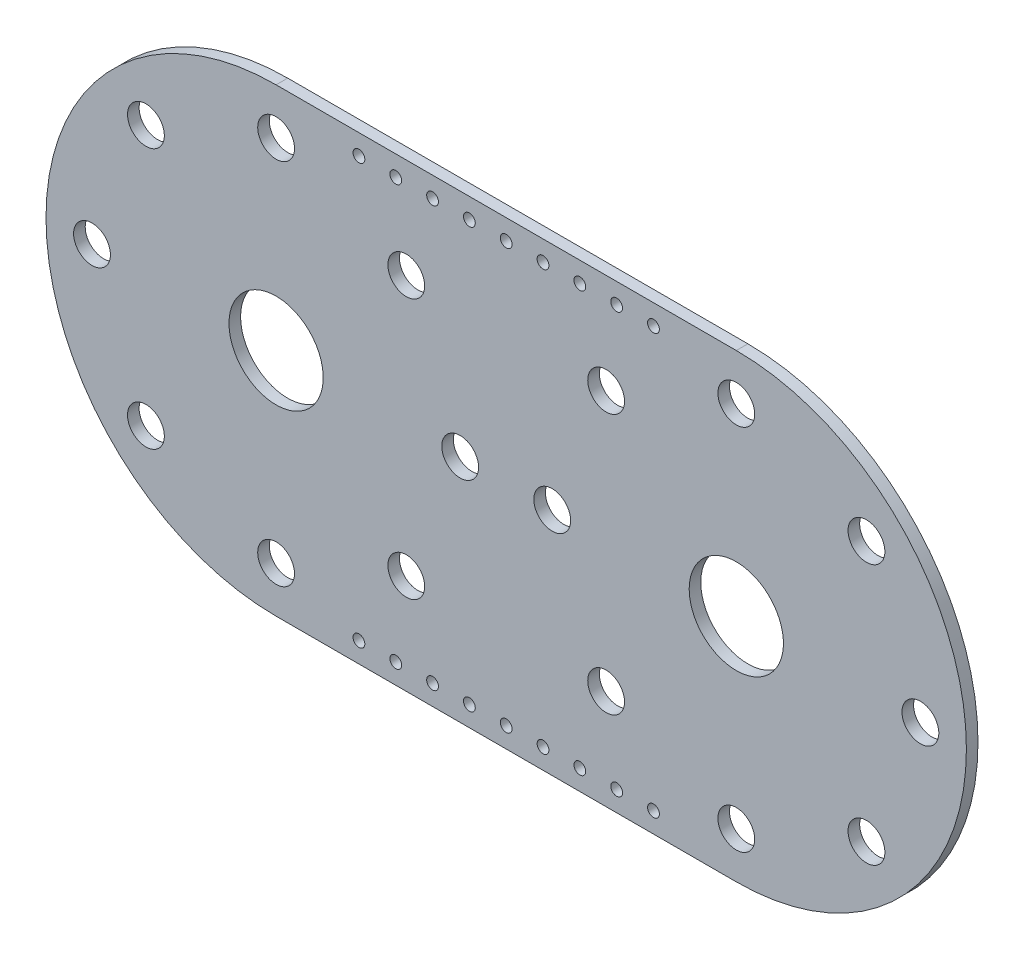
from build123d import *

# Parameters (mm, degrees)
SKETCH1_R           = 1.27
SKETCH1_R_2         = 3.2512
BOSS_EXTRUDE1_DEPTH = 0.800000051
SKETCH3_R           = 0.4064
CUT_EXTRUDE3_DEPTH  = 58.243716905


with BuildPart() as part:
    # Sketch1 → Boss-Extrude1 (new body)
    with BuildSketch(Plane.XY):
        with BuildLine():
            Line((31.75, 31.75), (0, 31.75))
            ThreePointArc((0, 31.75), (-15.875, 15.875), (0, 0))
            Line((0, 0), (31.75, 0))
            ThreePointArc((31.75, 0), (47.625, 15.875), (31.75, 31.75))
        make_face()
        with Locations((0, 3.175)):
            Circle(SKETCH1_R, mode=Mode.SUBTRACT)
        with Locations((-8.980256121, 6.894743879)):
            Circle(SKETCH1_R, mode=Mode.SUBTRACT)
        with Locations((8.980256121, 6.894743879)):
            Circle(SKETCH1_R, mode=Mode.SUBTRACT)
        with Locations((12.7, 15.875)):
            Circle(SKETCH1_R, mode=Mode.SUBTRACT)
        with Locations((22.769743879, 6.894743879)):
            Circle(SKETCH1_R, mode=Mode.SUBTRACT)
        with Locations((31.75, 3.175)):
            Circle(SKETCH1_R, mode=Mode.SUBTRACT)
        with Locations((40.730256121, 6.894743879)):
            Circle(SKETCH1_R, mode=Mode.SUBTRACT)
        with Locations((19.05, 15.875)):
            Circle(SKETCH1_R, mode=Mode.SUBTRACT)
        with Locations((-12.7, 15.875)):
            Circle(SKETCH1_R, mode=Mode.SUBTRACT)
        with Locations((0, 15.875)):
            Circle(SKETCH1_R_2, mode=Mode.SUBTRACT)
        with Locations((-8.980256121, 24.855256121)):
            Circle(SKETCH1_R, mode=Mode.SUBTRACT)
        with Locations((8.980256121, 24.855256121)):
            Circle(SKETCH1_R, mode=Mode.SUBTRACT)
        with Locations((0, 28.575)):
            Circle(SKETCH1_R, mode=Mode.SUBTRACT)
        with Locations((31.75, 15.875)):
            Circle(SKETCH1_R_2, mode=Mode.SUBTRACT)
        with Locations((44.45, 15.875)):
            Circle(SKETCH1_R, mode=Mode.SUBTRACT)
        with Locations((22.769743879, 24.855256121)):
            Circle(SKETCH1_R, mode=Mode.SUBTRACT)
        with Locations((31.75, 28.575)):
            Circle(SKETCH1_R, mode=Mode.SUBTRACT)
        with Locations((40.730256121, 24.855256121)):
            Circle(SKETCH1_R, mode=Mode.SUBTRACT)
    extrude(amount=BOSS_EXTRUDE1_DEPTH)

    # Sketch3 → Cut-Extrude3 (cut, through all)
    with BuildSketch(Plane(origin=(0, 0, 0.800000051), x_dir=(-1, 0, 0), z_dir=(0, 0, -1))):
        with Locations((-13.335, 30.353)):
            Circle(SKETCH3_R)
        with Locations((-10.795, 30.353)):
            Circle(SKETCH3_R)
        with Locations((-8.255, 30.353)):
            Circle(SKETCH3_R)
        with Locations((-5.715, 30.353)):
            Circle(SKETCH3_R)
        with Locations((-26.035, 30.353)):
            Circle(SKETCH3_R)
        with Locations((-23.495, 30.353)):
            Circle(SKETCH3_R)
        with Locations((-20.955, 30.353)):
            Circle(SKETCH3_R)
        with Locations((-18.415, 30.353)):
            Circle(SKETCH3_R)
        with Locations((-18.415, 1.397)):
            Circle(SKETCH3_R)
        with Locations((-20.955, 1.397)):
            Circle(SKETCH3_R)
        with Locations((-23.495, 1.397)):
            Circle(SKETCH3_R)
        with Locations((-26.035, 1.397)):
            Circle(SKETCH3_R)
        with Locations((-5.715, 1.397)):
            Circle(SKETCH3_R)
        with Locations((-8.255, 1.397)):
            Circle(SKETCH3_R)
        with Locations((-10.795, 1.397)):
            Circle(SKETCH3_R)
        with Locations((-13.335, 1.397)):
            Circle(SKETCH3_R)
        with Locations((-15.875, 30.353)):
            Circle(SKETCH3_R)
        with Locations((-15.875, 1.397)):
            Circle(SKETCH3_R)
    extrude(amount=CUT_EXTRUDE3_DEPTH, mode=Mode.SUBTRACT)


solid = part.part
